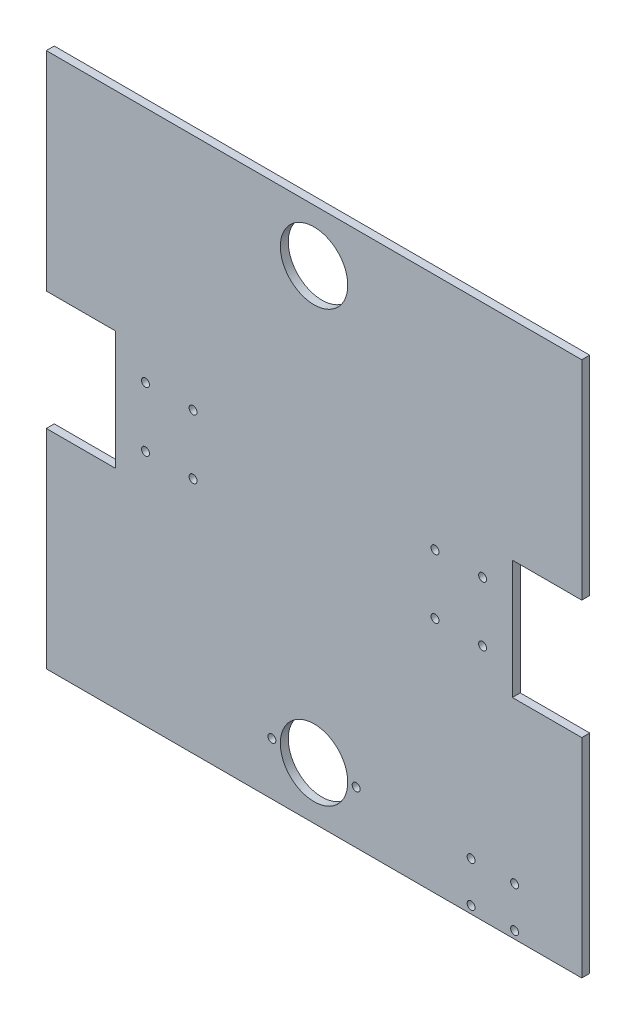
from build123d import *

# Parameters (mm, degrees)
SKETCH1_W           = 270
SKETCH1_H           = 270
BOSS_EXTRUDE1_DEPTH = 4
SKETCH2_R           = 2
SKETCH2_W           = 35
SKETCH2_H           = 60
CUT_EXTRUDE1_DEPTH  = 191.960728947
SKETCH3_R           = 17
CUT_EXTRUDE2_DEPTH  = 191.960728947
SKETCH4_R           = 2
CUT_EXTRUDE3_DEPTH  = 191.960728947
SKETCH5_R           = 2
CUT_EXTRUDE4_DEPTH  = 191.960728947


with BuildPart() as part:
    # Sketch1 → Boss-Extrude1 (new body)
    with BuildSketch(Plane.XY):
        Rectangle(SKETCH1_W, SKETCH1_H)
    extrude(amount=BOSS_EXTRUDE1_DEPTH)

    # Sketch2 → Cut-Extrude1 (cut, through all)
    with BuildSketch(Plane.XY.offset(4)):
        with Locations((-85, 15)):
            Circle(SKETCH2_R)
        with Locations((-61, 15)):
            Circle(SKETCH2_R)
        with Locations((-61, -15)):
            Circle(SKETCH2_R)
        with Locations((-85, -15)):
            Circle(SKETCH2_R)
        with Locations((-117.5, 0)):
            Rectangle(SKETCH2_W, SKETCH2_H)
    cut_extrude1 = extrude(amount=-CUT_EXTRUDE1_DEPTH, mode=Mode.SUBTRACT)

    # Sketch3 → Cut-Extrude2 (cut, through all)
    with BuildSketch(Plane.XY.offset(4)):
        with Locations((0, -108.5)):
            Circle(SKETCH3_R)
    cut_extrude2 = extrude(amount=-CUT_EXTRUDE2_DEPTH, mode=Mode.SUBTRACT)

    # Mirror1: Cut-Extrude1 across plane
    add(cut_extrude1.mirror(Plane(origin=(0, 0, 0), x_dir=(0, 0, 1), z_dir=(1, 0, 0))), mode=Mode.SUBTRACT)

    # Mirror2: Cut-Extrude2 across plane
    add(cut_extrude2.mirror(Plane.ZX), mode=Mode.SUBTRACT)

    # Sketch4 → Cut-Extrude3 (cut, through all)
    with BuildSketch(Plane.XY.offset(4)):
        with Locations((21.25, -108.5)):
            Circle(SKETCH4_R)
        with Locations((-21.25, -108.5)):
            Circle(SKETCH4_R)
    extrude(amount=-CUT_EXTRUDE3_DEPTH, mode=Mode.SUBTRACT)

    # Sketch5 → Cut-Extrude4 (cut, through all)
    with BuildSketch(Plane.XY.offset(4)):
        with Locations((79.206538854, -131.234773755)):
            Circle(SKETCH5_R)
        with Locations((79.206538854, -110.765226245)):
            Circle(SKETCH5_R)
        with Locations((101.138196901, -110.765226245)):
            Circle(SKETCH5_R)
        with Locations((101.138196901, -131.234773755)):
            Circle(SKETCH5_R)
    extrude(amount=-CUT_EXTRUDE4_DEPTH, mode=Mode.SUBTRACT)


solid = part.part
